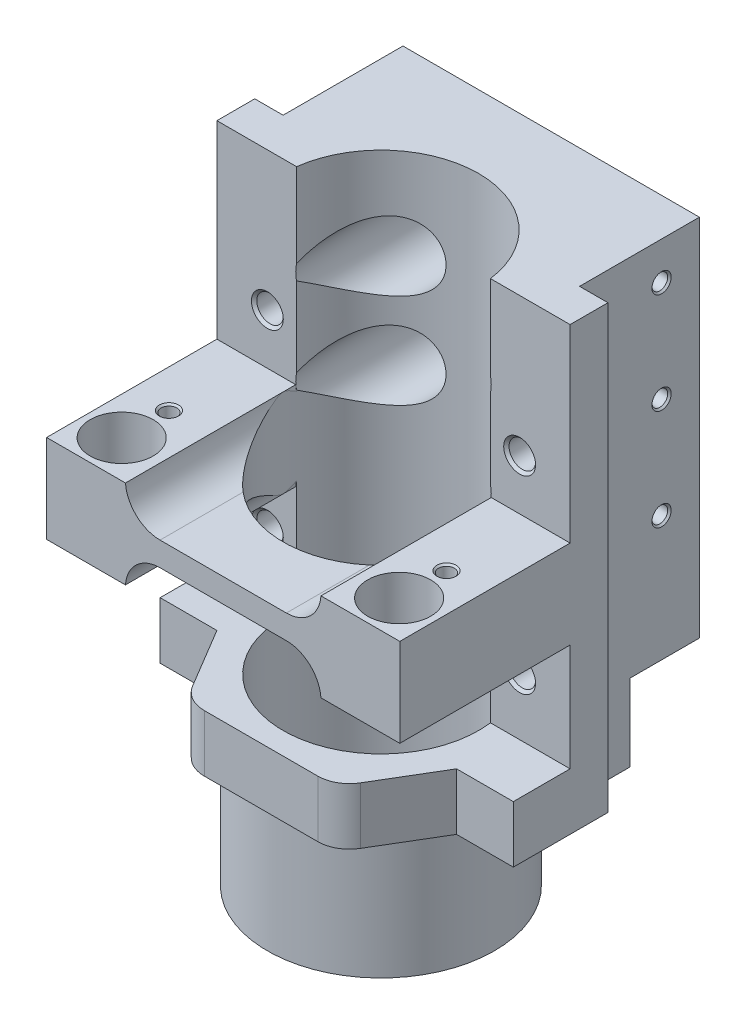
from build123d import *

# Parameters (mm, degrees)
BOSS_EXTRUDE1_DEPTH        = 22
BOSS_EXTRUDE1_DEPTH_BACK   = 48
BOSS_EXTRUDE2_START        = -48
BOSS_EXTRUDE2_DEPTH        = 9
SKETCH2_R                  = 18
SKETCH2_R_2                = 13
BOSS_EXTRUDE3_DEPTH        = 20
CUT_EXTRUDE1_DEPTH         = 87.740993769
CUT_EXTRUDE1_DEPTH_BACK    = 87.740993769
SKETCH3_W                  = 11
SKETCH3_H                  = 32.2
CUT_EXTRUDE4_DEPTH         = 11
M3_TAPPED_HOLE1_AT_2_COUNT = 2
M3_TAPPED_HOLE1_AT_2_PITCH = 16
M3_TAPPED_HOLE1_AT_3_COUNT = 2
M3_TAPPED_HOLE1_AT_3_PITCH = 32
SKETCH10_R                 = 3
CUT_EXTRUDE6_DEPTH         = 87.740993769
CUT_EXTRUDE7_START         = -4
SKETCH10_3_R               = 5.5
SKETCH10_3_R_2             = 3
CUT_EXTRUDE7_DEPTH         = 83.740993769
BOSS_EXTRUDE5_DEPTH        = 27
CUT_EXTRUDE8_START         = -3.5
SKETCH11_R                 = 15.5
CUT_EXTRUDE8_DEPTH         = 105.147573126
SKETCH16_R                 = 4
CUT_EXTRUDE9_DEPTH         = 85.190260781
SKETCH16_3_R               = 5
SKETCH16_3_R_2             = 4
CUT_EXTRUDE10_DEPTH        = 12


# Read off the part's stored shape, not the designer's step: M5 Tapped Hole1
with BuildPart() as part:
    # Sketch1 → Boss-Extrude1 (new, two sides: drawn at the far end of the back side and taken through both)
    with BuildSketch(Plane(origin=(0, 0, 0), x_dir=(1, 0, 0), z_dir=(0, 1, 0)).offset(-BOSS_EXTRUDE1_DEPTH_BACK)):
        Polygon((0, -25), (0, 0), (-23.5, 0), (-23.5, -19), (-28, -19), (-28, -25), align=None)
        Polygon((23.5, 0), (0, 0), (0, -25), (28, -25), (28, -19), (23.5, -19), align=None)
    extrude(amount=BOSS_EXTRUDE1_DEPTH + BOSS_EXTRUDE1_DEPTH_BACK)

    # Sketch1<3> → Boss-Extrude2 (add)
    with BuildSketch(Plane(origin=(0, 0, 0), x_dir=(1, 0, 0), z_dir=(0, 1, 0)).offset(BOSS_EXTRUDE2_START)):
        with BuildLine():
            Line((28, -25), (0, -25))
            Line((0, -25), (0, -46))
            Line((0, -46), (9, -46))
            ThreePointArc((9, -46), (11.468674765, -45.348062201), (13.293580573, -43.562257962))
            Line((13.293580573, -43.562257962), (19, -34))
            Line((19, -34), (28, -34))
            Line((28, -34), (28, -25))
        make_face()
        with BuildLine():
            Line((0, -46), (0, -25))
            Line((0, -25), (-28, -25))
            Line((-28, -25), (-28, -34))
            Line((-28, -34), (-19, -34))
            Line((-19, -34), (-13.293580573, -43.562257962))
            ThreePointArc((-13.293580573, -43.562257962), (-11.468674765, -45.348062201), (-9, -46))
            Line((-9, -46), (0, -46))
        make_face()
    extrude(amount=BOSS_EXTRUDE2_DEPTH)

    # Sketch2 → Boss-Extrude3 (add)
    with BuildSketch(Plane.XZ.offset(48)):
        with Locations(Location((0, 27, 0), (0, 0, 90))):
            Circle(SKETCH2_R)
        with Locations(Location((0, 27, 0), (0, 0, 270))):
            Circle(SKETCH2_R_2, mode=Mode.SUBTRACT)
    extrude(amount=BOSS_EXTRUDE3_DEPTH)

    # Sketch3 → Cut-Extrude1 (cut, two sides: drawn at the far end of the back side and taken through both)
    with BuildSketch(Plane(origin=(0, 0, 0), x_dir=(0, 0, -1), z_dir=(1, 0, 0)).offset(-CUT_EXTRUDE1_DEPTH_BACK)):
        with Locations((-5.5, -51.9)):
            Rectangle(SKETCH3_W, SKETCH3_H)
    extrude(amount=CUT_EXTRUDE1_DEPTH + CUT_EXTRUDE1_DEPTH_BACK, mode=Mode.SUBTRACT)

    # Sketch4 → Cut-Extrude4 (cut)
    with BuildSketch(Plane(origin=(0, 0, 0), x_dir=(-1, 0, 0), z_dir=(0, 0, -1))):
        with BuildLine():
            Line((-5, 0), (-5, -35.8))
            Line((-5, -35.8), (5, -35.8))
            Line((5, -35.8), (5, 0))
            ThreePointArc((5, 0), (0, 5), (-5, 0))
        make_face()
    extrude(amount=-CUT_EXTRUDE4_DEPTH, mode=Mode.SUBTRACT)

    # Sketch6 → M3 Tapped Hole1 (revolve, cut)
    with BuildSketch(Plane(origin=(23.5, 16, 6), x_dir=(0, 0, -1), z_dir=(0, 1, 0))):
        Polygon((0, 0), (0, 7.751075774), (1.25, 7), (1.25, 0.275), (1.525, 0), align=None)
    m3_tapped_hole1 = revolve(axis=Axis((29.85, 16, 6), (-1, 0, 0)), mode=Mode.SUBTRACT)

    # M3 Tapped Hole1 at 2: M3 Tapped Hole1 ×2
    with Locations(*[(0, -i * M3_TAPPED_HOLE1_AT_2_PITCH, 0) for i in range(1, M3_TAPPED_HOLE1_AT_2_COUNT)]):
        add(m3_tapped_hole1, mode=Mode.SUBTRACT)

    # M3 Tapped Hole1 at 3: M3 Tapped Hole1 ×2
    with Locations(*[(0, -i * M3_TAPPED_HOLE1_AT_3_PITCH, 0) for i in range(1, M3_TAPPED_HOLE1_AT_3_COUNT)]):
        add(m3_tapped_hole1, mode=Mode.SUBTRACT)

    # Mirror1: M3 Tapped Hole1 across plane
    add(m3_tapped_hole1.mirror(Plane(origin=(0, 0, 0), x_dir=(0, 0, 1), z_dir=(1, 0, 0))), mode=Mode.SUBTRACT)

    # Mirror1 copy 1 sketch → Mirror1 copy 1 (revolve, cut)
    with BuildSketch(Plane(origin=(-23.5, 0, 6), x_dir=(0, 0, -1), z_dir=(0, 1, 0))):
        Polygon((0, 0), (0, -7.751075774), (1.25, -7), (1.25, -0.275), (1.525, 0), align=None)
    revolve(axis=Axis((-29.85, 0, 6), (-1, 0, 0)), mode=Mode.SUBTRACT)

    # Mirror1 copy 2 sketch → Mirror1 copy 2 (revolve, cut)
    with BuildSketch(Plane(origin=(-23.5, -16, 6), x_dir=(0, 0, -1), z_dir=(0, 1, 0))):
        Polygon((0, 0), (0, -7.751075774), (1.25, -7), (1.25, -0.275), (1.525, 0), align=None)
    revolve(axis=Axis((-29.85, -16, 6), (-1, 0, 0)), mode=Mode.SUBTRACT)

    # Sketch10 → Cut-Extrude6 (cut, through all)
    with BuildSketch(Plane(origin=(0, 0, 0), x_dir=(-1, 0, 0), z_dir=(0, 0, -1))):
        with Locations((-10, 7.5)):
            Circle(SKETCH10_R)
        with Locations((10, 7.5)):
            Circle(SKETCH10_R)
        with Locations((10, -7.5)):
            Circle(SKETCH10_R)
        with Locations((-10, -7.5)):
            Circle(SKETCH10_R)
    extrude(amount=-CUT_EXTRUDE6_DEPTH, mode=Mode.SUBTRACT)

    # Sketch10<3> → Cut-Extrude7 (cut, through all)
    # profile 1 of 4: a face of its own
    with BuildSketch(Plane(origin=(0, 0, 0), x_dir=(-1, 0, 0), z_dir=(0, 0, -1)).offset(CUT_EXTRUDE7_START)):
        with Locations((-10, 7.5)):
            Circle(SKETCH10_3_R)
        with Locations((-10, 7.5)):
            Circle(SKETCH10_3_R_2, mode=Mode.SUBTRACT)
    # profile 2 of 4: a face of its own
    with BuildSketch(Plane(origin=(0, 0, 0), x_dir=(-1, 0, 0), z_dir=(0, 0, -1)).offset(CUT_EXTRUDE7_START)):
        with Locations((10, 7.5)):
            Circle(SKETCH10_3_R)
        with Locations((10, 7.5)):
            Circle(SKETCH10_3_R_2, mode=Mode.SUBTRACT)
    # profile 3 of 4: a face of its own
    with BuildSketch(Plane(origin=(0, 0, 0), x_dir=(-1, 0, 0), z_dir=(0, 0, -1)).offset(CUT_EXTRUDE7_START)):
        with Locations(Location((10, -7.5, 0), (0, 0, 155.380022671))):
            Circle(SKETCH10_3_R)
        with Locations((10, -7.5)):
            Circle(SKETCH10_3_R_2, mode=Mode.SUBTRACT)
    # profile 4 of 4: a face of its own
    with BuildSketch(Plane(origin=(0, 0, 0), x_dir=(-1, 0, 0), z_dir=(0, 0, -1)).offset(CUT_EXTRUDE7_START)):
        with Locations(Location((-10, -7.5, 0), (0, 0, 335.380022671))):
            Circle(SKETCH10_3_R)
        with Locations((-10, -7.5)):
            Circle(SKETCH10_3_R_2, mode=Mode.SUBTRACT)
    extrude(amount=-CUT_EXTRUDE7_DEPTH, mode=Mode.SUBTRACT)

    # Sketch14 → Boss-Extrude5 (add)
    with BuildSketch(Plane.XY.offset(25)):
        with BuildLine():
            Line((-28, -8), (-15.5, -8))
            ThreePointArc((-15.5, -8), (-13.759561401, -11.628026812), (-10.014564739, -13.1))
            Line((-10.014564739, -13.1), (10.014564739, -13.1))
            ThreePointArc((10.014564739, -13.1), (13.759561401, -11.628026812), (15.5, -8))
            Line((15.5, -8), (28, -8))
            Line((28, -8), (28, -22))
            Line((28, -22), (15.5, -22))
            ThreePointArc((15.5, -22), (13.759561401, -18.371973188), (10.014564739, -16.9))
            Line((10.014564739, -16.9), (-10.014564739, -16.9))
            ThreePointArc((-10.014564739, -16.9), (-13.759561401, -18.371973188), (-15.5, -22))
            Line((-15.5, -22), (-28, -22))
            Line((-28, -22), (-28, -8))
        make_face()
    extrude(amount=BOSS_EXTRUDE5_DEPTH)

    # M5 Tapped Hole1 outline → M5 Tapped Hole1 (revolve, cut)
    with BuildSketch(Plane(origin=(20, 0, 0), x_dir=(1, 0, 0), z_dir=(0, -1, 0))):
        Polygon((0, 25), (0, 8.1381927), (2.1, 9.4), (2.1, 24.575), (2.525, 25), align=None)
    revolve(axis=Axis((20, 0, 0), (0, 0, 1)), mode=Mode.SUBTRACT)

    # M5 Tapped Hole1 2 outline → M5 Tapped Hole1 2 (revolve, cut)
    with BuildSketch(Plane(origin=(-20, -30, 0), x_dir=(1, 0, 0), z_dir=(0, -1, 0))):
        Polygon((0, 25), (0, 8.1381927), (2.1, 9.4), (2.1, 24.575), (2.525, 25), align=None)
    revolve(axis=Axis((-20, -30, 0), (0, 0, 1)), mode=Mode.SUBTRACT)

    # M5 Tapped Hole1 3 outline → M5 Tapped Hole1 3 (revolve, cut)
    with BuildSketch(Plane(origin=(-20, 0, 0), x_dir=(1, 0, 0), z_dir=(0, -1, 0))):
        Polygon((0, 25), (0, 8.1381927), (2.1, 9.4), (2.1, 24.575), (2.525, 25), align=None)
    revolve(axis=Axis((-20, 0, 0), (0, 0, 1)), mode=Mode.SUBTRACT)

    # M5 Tapped Hole1 4 outline → M5 Tapped Hole1 4 (revolve, cut)
    with BuildSketch(Plane(origin=(20, -30, 0), x_dir=(1, 0, 0), z_dir=(0, -1, 0))):
        Polygon((0, 25), (0, 8.1381927), (2.1, 9.4), (2.1, 24.575), (2.525, 25), align=None)
    revolve(axis=Axis((20, -30, 0), (0, 0, 1)), mode=Mode.SUBTRACT)

    # Sketch11 → Cut-Extrude8 (cut, through all)
    with BuildSketch(Plane.XZ.offset(68).offset(CUT_EXTRUDE8_START)):
        with Locations(Location((0, 27, 0), (0, 0, 270))):
            Circle(SKETCH11_R)
    extrude(amount=-CUT_EXTRUDE8_DEPTH, mode=Mode.SUBTRACT)

    # Sketch16 → Cut-Extrude9 (cut, through all)
    with BuildSketch(Plane(origin=(0, -8, 0), x_dir=(1, 0, 0), z_dir=(0, 1, 0))):
        with Locations(Location((-22, -46.1, 0), (0, 0, 180))):
            Circle(SKETCH16_R)
    cut_extrude9 = extrude(amount=-CUT_EXTRUDE9_DEPTH, mode=Mode.SUBTRACT)

    # Sketch16<3> → Cut-Extrude10 (cut)
    with BuildSketch(Plane(origin=(0, -8, 0), x_dir=(1, 0, 0), z_dir=(0, 1, 0))):
        with Locations(Location((-22, -46.1, 0), (0, 0, 180))):
            Circle(SKETCH16_3_R)
        with Locations(Location((-22, -46.1, 0), (0, 0, 180))):
            Circle(SKETCH16_3_R_2, mode=Mode.SUBTRACT)
    cut_extrude10 = extrude(amount=-CUT_EXTRUDE10_DEPTH, mode=Mode.SUBTRACT)

    # Sketch18 → M3 Tapped Hole2 (revolve, cut)
    with BuildSketch(Plane(origin=(-22, -8, 38.6), x_dir=(0, 0, 1), z_dir=(1, 0, 0))):
        Polygon((0, 0), (0, 60.151075774), (1.25, 59.4), (1.25, 0.275), (1.525, 0), align=None)
    m3_tapped_hole2 = revolve(axis=Axis((-22, -1.65, 38.6), (0, -1, 0)), mode=Mode.SUBTRACT)

    # Mirror3: Cut-Extrude9, Cut-Extrude10, M3 Tapped Hole2 across plane
    add(cut_extrude9.mirror(Plane(origin=(0, 0, 0), x_dir=(0, 0, 1), z_dir=(1, 0, 0))), mode=Mode.SUBTRACT)
    add(cut_extrude10.mirror(Plane(origin=(0, 0, 0), x_dir=(0, 0, 1), z_dir=(1, 0, 0))), mode=Mode.SUBTRACT)
    add(m3_tapped_hole2.mirror(Plane(origin=(0, 0, 0), x_dir=(0, 0, 1), z_dir=(1, 0, 0))), mode=Mode.SUBTRACT)


solid = part.part
